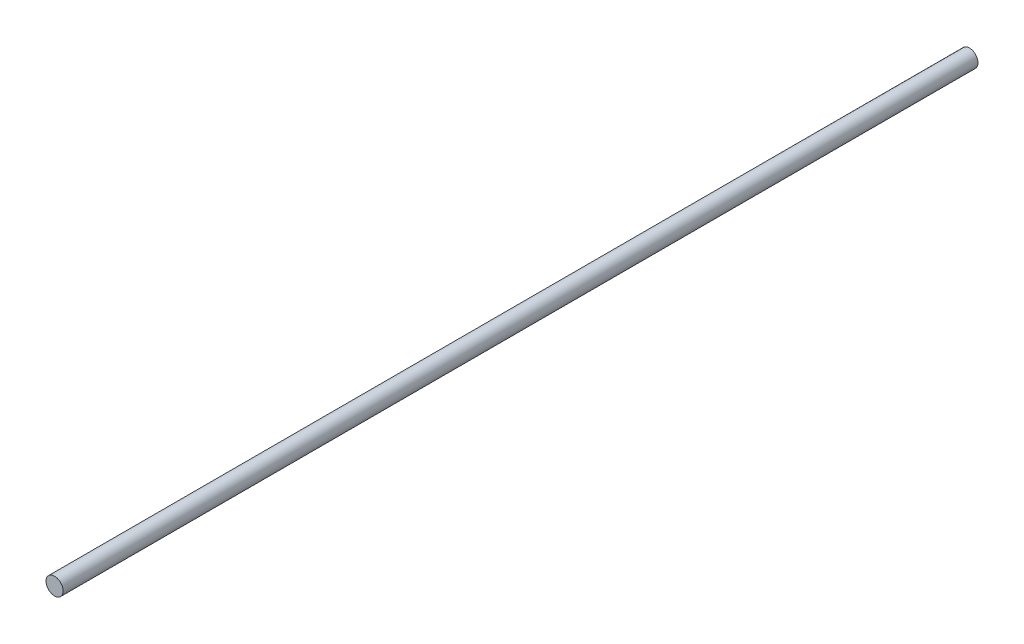
from build123d import *

# Parameters (mm, degrees)
ESQUISSE1_R        = 1.5
BOSS_EXTRU_1_DEPTH = 160


with BuildPart() as part:
    # Esquisse1 → Boss.-Extru.1 (new body)
    with BuildSketch(Plane.XY):
        Circle(ESQUISSE1_R)
    extrude(amount=BOSS_EXTRU_1_DEPTH)


solid = part.part
